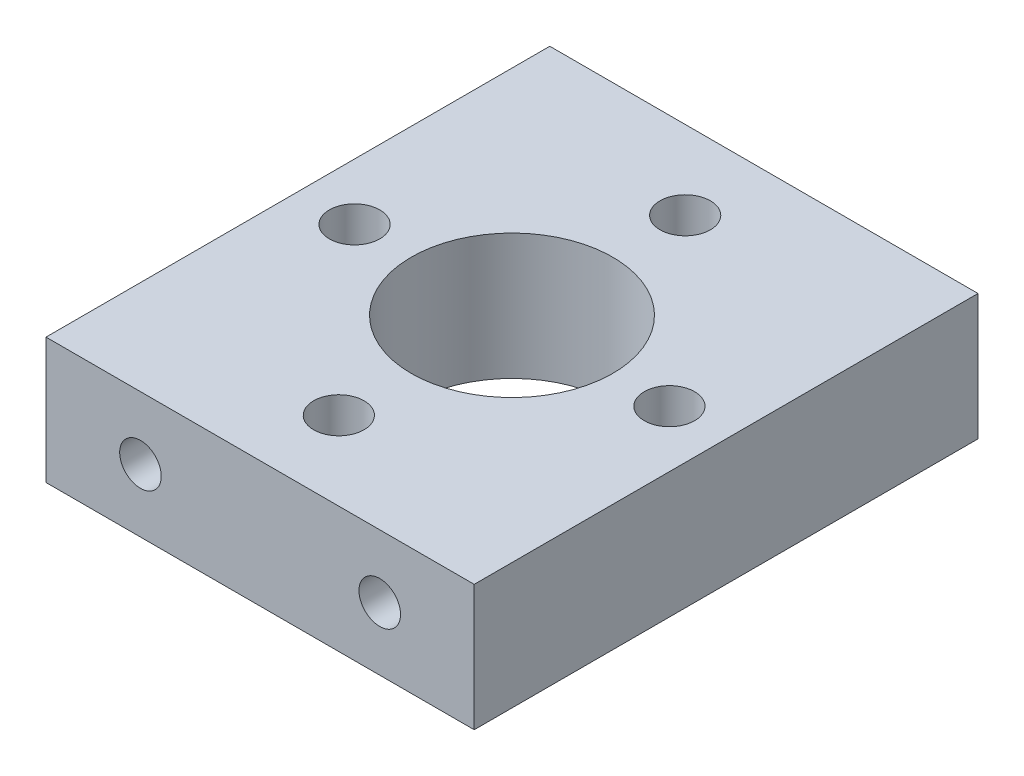
from build123d import *

# Parameters (mm, degrees)
SKETCH1_W                           = 34
SKETCH1_H                           = 40
SKETCH1_R                           = 8
SKETCH1_R_2                         = 2
BOSS_EXTRUDE1_DEPTH                 = 10
M4X0_7_TAPPED_HOLE1_D               = 3.3
M4X0_7_TAPPED_HOLE1_DEPTH           = 15
M4X0_7_TAPPED_HOLE1_TIP             = 0.991420021
M4X0_7_TAPPED_HOLE1_ON_FACE_2_D     = 3.3
M4X0_7_TAPPED_HOLE1_ON_FACE_2_DEPTH = 15
M4X0_7_TAPPED_HOLE1_ON_FACE_2_TIP   = 0.991420021


with BuildPart() as part:
    # Sketch1 → Boss-Extrude1 (new body)
    with BuildSketch(Plane(origin=(0, 0, 0), x_dir=(1, 0, 0), z_dir=(0, 1, 0))):
        Rectangle(SKETCH1_W, SKETCH1_H)
        Circle(SKETCH1_R, mode=Mode.SUBTRACT)
        with Locations((0, 13.75)):
            Circle(SKETCH1_R_2, mode=Mode.SUBTRACT)
        with Locations((0, -13.75)):
            Circle(SKETCH1_R_2, mode=Mode.SUBTRACT)
        with Locations((-12.5, 0)):
            Circle(SKETCH1_R_2, mode=Mode.SUBTRACT)
        with Locations((12.5, 0)):
            Circle(SKETCH1_R_2, mode=Mode.SUBTRACT)
    extrude(amount=BOSS_EXTRUDE1_DEPTH)

    # M4x0.7 Tapped Hole1
    with Locations(Plane(origin=(9.5, 5, -20), x_dir=(-1, 0, 0), z_dir=(0, 0, -1))):
        with Locations((0, 0), (19, 0)):
            Hole(M4X0_7_TAPPED_HOLE1_D / 2, depth=M4X0_7_TAPPED_HOLE1_DEPTH)
            with Locations((0, 0, -(M4X0_7_TAPPED_HOLE1_DEPTH + M4X0_7_TAPPED_HOLE1_TIP / 2))):  # 118° drill point
                Cone(0, M4X0_7_TAPPED_HOLE1_D / 2, M4X0_7_TAPPED_HOLE1_TIP, mode=Mode.SUBTRACT)

    # M4x0.7 Tapped Hole1 on face 2
    with Locations(Plane(origin=(-9.5, 5, 20), x_dir=(1, 0, 0), z_dir=(0, 0, 1))):
        with Locations((0, 0), (19, 0)):
            Hole(M4X0_7_TAPPED_HOLE1_ON_FACE_2_D / 2, depth=M4X0_7_TAPPED_HOLE1_ON_FACE_2_DEPTH)
            with Locations((0, 0, -(M4X0_7_TAPPED_HOLE1_ON_FACE_2_DEPTH + M4X0_7_TAPPED_HOLE1_ON_FACE_2_TIP / 2))):  # 118° drill point
                Cone(0, M4X0_7_TAPPED_HOLE1_ON_FACE_2_D / 2, M4X0_7_TAPPED_HOLE1_ON_FACE_2_TIP, mode=Mode.SUBTRACT)


solid = part.part
